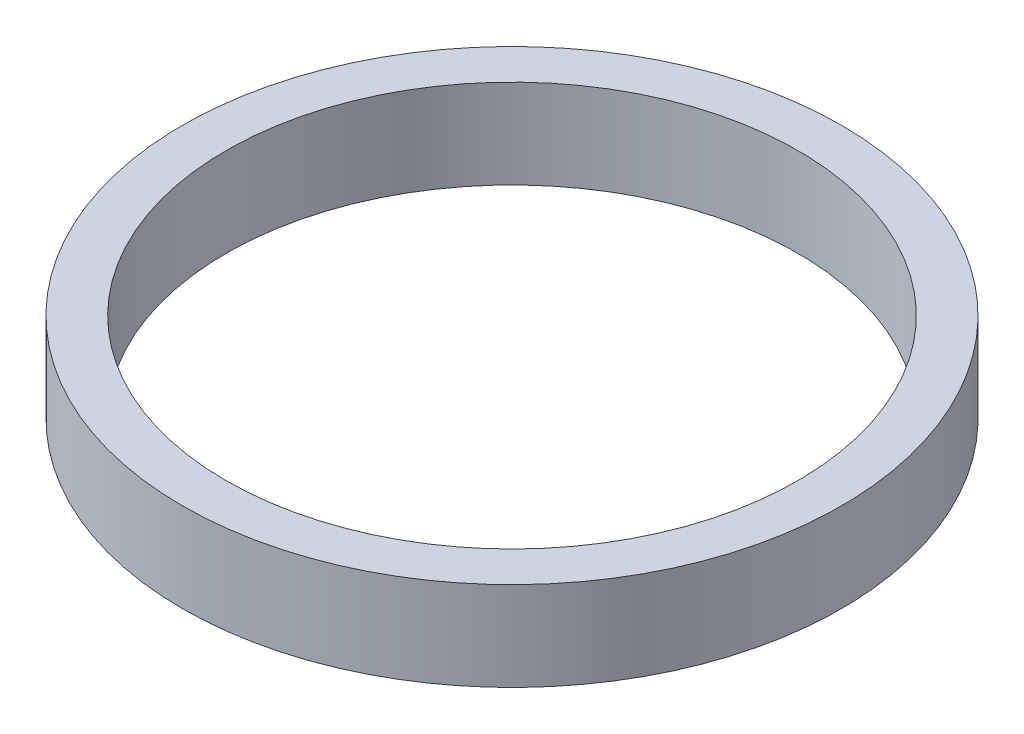
from build123d import *

# Parameters (mm, degrees)
SKETCH2_R           = 18.5
SKETCH2_R_2         = 16.05
BOSS_EXTRUDE1_DEPTH = 5


with BuildPart() as part:
    # Sketch2 → Boss-Extrude1 (new body)
    with BuildSketch(Plane(origin=(0, 9, 0), x_dir=(1, 0, 0), z_dir=(0, 1, 0))):
        with Locations((-0.5, 0)):
            Circle(SKETCH2_R)
        with Locations((-0.5, 0)):
            Circle(SKETCH2_R_2, mode=Mode.SUBTRACT)
    extrude(amount=BOSS_EXTRUDE1_DEPTH)


solid = part.part
